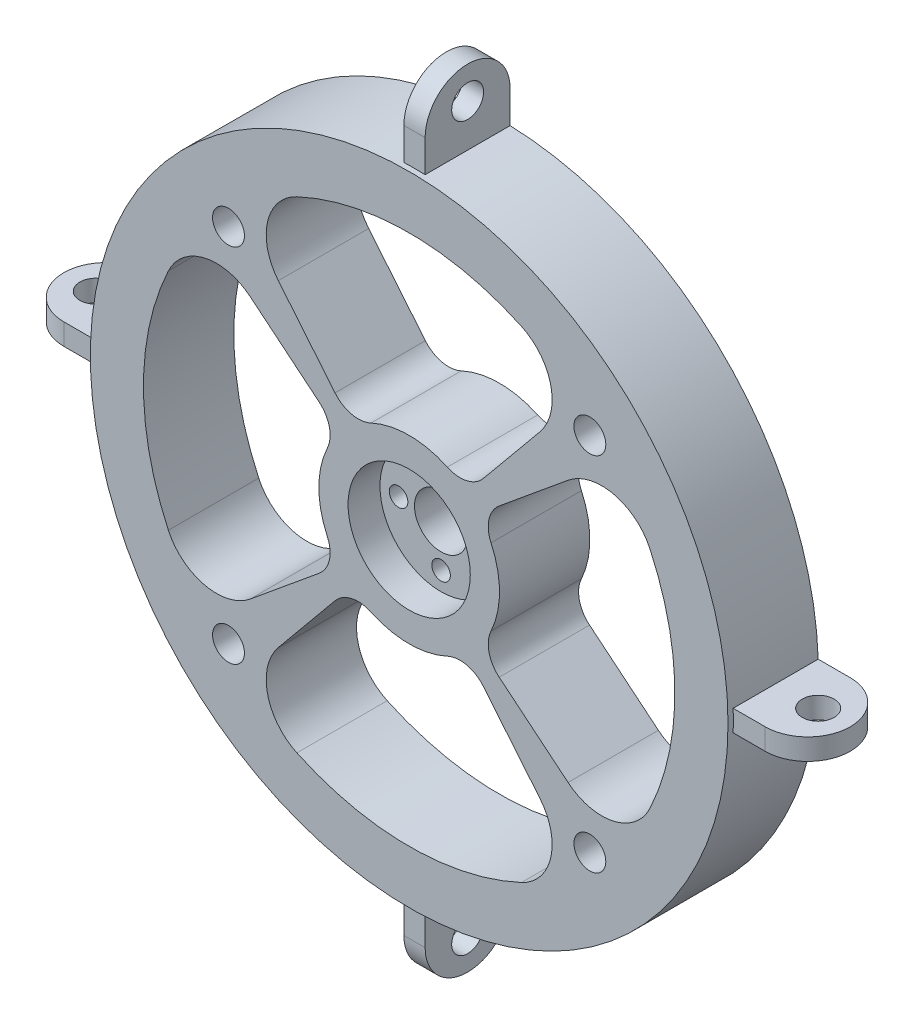
from build123d import *

# Parameters (mm, degrees)
SKETCH_1_R               = 60
EXTRUDE_1_DEPTH          = 17
SKETCH_2_R               = 3
CUT_EXTRUDE_1_DEPTH      = 87.539008545
EXTRUDE_2_DEPTH          = 2
SKETCH_4_R               = 3
CUT_EXTRUDE_7_DEPTH      = 99.025506885
CUT_EXTRUDE_3_REACH      = 98.773
SKETCH_5_R               = 5
SKETCH_6_R               = 11.5
CUT_EXTRUDE_4_DEPTH      = 6
CUT_EXTRUDE_5_REACH      = 97.901
SKETCH_7_R               = 1.75
CUT_EXTRUDE_6_REACH      = 98.773
PATTERN_CIRCULAR_3_COUNT = 4
PATTERN_CIRCULAR_4_COUNT = 4


with BuildPart() as part:
    # 草图1 → 凸台-拉伸1 (new body)
    with BuildSketch(Plane.XY):
        Circle(SKETCH_1_R)
    extrude(amount=EXTRUDE_1_DEPTH)

    # 草图2 → 切除-拉伸1 (cut, through all)
    with BuildSketch(Plane.XY.offset(17)):
        with Locations((-34, 34)):
            Circle(SKETCH_2_R)
        with Locations((34, 34)):
            Circle(SKETCH_2_R)
        with Locations((34, -34)):
            Circle(SKETCH_2_R)
        with Locations((-34, -34)):
            Circle(SKETCH_2_R)
    extrude(amount=-CUT_EXTRUDE_1_DEPTH, mode=Mode.SUBTRACT)

    # 草图3 → 凸台-拉伸2 (add, symmetric)
    with BuildSketch(Plane(origin=(0, 0, 0), x_dir=(0, 0, -1), z_dir=(1, 0, 0))):
        with BuildLine():
            Line((0, 58), (-16, 58))
            Line((-16, 58), (-16, 66))
            ThreePointArc((-16, 66), (-8, 74), (0, 66))
            Line((0, 66), (0, 58))
        make_face()
    extrude_2 = extrude(amount=EXTRUDE_2_DEPTH, both=True)

    # 草图4 → 切除-拉伸7 (cut, through all)
    with BuildSketch(Plane(origin=(2, 0, 0), x_dir=(0, 0, -1), z_dir=(1, 0, 0))):
        with Locations((-8, 67.966657402)):
            Circle(SKETCH_4_R)
    cut_extrude_7 = extrude(amount=-CUT_EXTRUDE_7_DEPTH, mode=Mode.SUBTRACT)

    # 草图5 → 切除-拉伸3 (cut, up to next)
    with BuildSketch(Plane(origin=(0, 0, 0), x_dir=(-1, 0, 0), z_dir=(0, 0, -1)), mode=Mode.PRIVATE) as cut_extrude_3_sk1:
        Circle(SKETCH_5_R)
    cut_extrude_3_tool1 = extrude(cut_extrude_3_sk1.sketch, amount=-CUT_EXTRUDE_3_REACH, mode=Mode.PRIVATE) & part.part
    add(cut_extrude_3_tool1.solids().sort_by_distance((0, 0, 0))[0], mode=Mode.SUBTRACT)

    # 草图6 → 切除-拉伸4 (cut)
    with BuildSketch(Plane.XY.offset(17)):
        Circle(SKETCH_6_R)
    extrude(amount=-CUT_EXTRUDE_4_DEPTH, mode=Mode.SUBTRACT)

    # 草图7 → 切除-拉伸5 (cut, up to next)
    with BuildSketch(Plane.XY.offset(11), mode=Mode.PRIVATE) as cut_extrude_5_sk1:
        with Locations((-8, 0)):
            Circle(SKETCH_7_R)
    cut_extrude_5_tool1 = extrude(cut_extrude_5_sk1.sketch, amount=-CUT_EXTRUDE_5_REACH, mode=Mode.PRIVATE) & part.part
    # 草图7 → 切除-拉伸5 (cut, up to next)
    with BuildSketch(Plane.XY.offset(11), mode=Mode.PRIVATE) as cut_extrude_5_sk2:
        with Locations((0, 8)):
            Circle(SKETCH_7_R)
    cut_extrude_5_tool2 = extrude(cut_extrude_5_sk2.sketch, amount=-CUT_EXTRUDE_5_REACH, mode=Mode.PRIVATE) & part.part
    # 草图7 → 切除-拉伸5 (cut, up to next)
    with BuildSketch(Plane.XY.offset(11), mode=Mode.PRIVATE) as cut_extrude_5_sk3:
        with Locations((8, 0)):
            Circle(SKETCH_7_R)
    cut_extrude_5_tool3 = extrude(cut_extrude_5_sk3.sketch, amount=-CUT_EXTRUDE_5_REACH, mode=Mode.PRIVATE) & part.part
    # 草图7 → 切除-拉伸5 (cut, up to next)
    with BuildSketch(Plane.XY.offset(11), mode=Mode.PRIVATE) as cut_extrude_5_sk4:
        with Locations((0, -8)):
            Circle(SKETCH_7_R)
    cut_extrude_5_tool4 = extrude(cut_extrude_5_sk4.sketch, amount=-CUT_EXTRUDE_5_REACH, mode=Mode.PRIVATE) & part.part
    add(cut_extrude_5_tool1.solids().sort_by_distance((-8, 0, 11))[0], mode=Mode.SUBTRACT)
    add(cut_extrude_5_tool2.solids().sort_by_distance((0, 8, 11))[0], mode=Mode.SUBTRACT)
    add(cut_extrude_5_tool3.solids().sort_by_distance((8, 0, 11))[0], mode=Mode.SUBTRACT)
    add(cut_extrude_5_tool4.solids().sort_by_distance((0, -8, 11))[0], mode=Mode.SUBTRACT)

    # 草图8 → 切除-拉伸6 (cut, up to next)
    with BuildSketch(Plane.XY.offset(17), mode=Mode.PRIVATE) as cut_extrude_6_sk1:
        with BuildLine():
            Line((-16.940249698, 13.95330093), (-29.89455829, 24.62347223))
            ThreePointArc((-29.89455829, 24.62347223), (-38.461199832, 26.657720383), (-45.315389352, 21.130913087))
            ThreePointArc((-45.315389352, 21.130913087), (-50, 0), (-45.315389352, -21.130913087))
            ThreePointArc((-45.315389352, -21.130913087), (-38.461199832, -26.657720383), (-29.89455829, -24.62347223))
            Line((-29.89455829, -24.62347223), (-16.940249698, -13.95330093))
            ThreePointArc((-16.940249698, -13.95330093), (-15.016282222, -10.831050665), (-15.40723238, -7.18451045))
            ThreePointArc((-15.40723238, -7.18451045), (-17, 0), (-15.40723238, 7.18451045))
            ThreePointArc((-15.40723238, 7.18451045), (-15.016282222, 10.831050665), (-16.940249698, 13.95330093))
        make_face()
    cut_extrude_6_tool1 = extrude(cut_extrude_6_sk1.sketch, amount=-CUT_EXTRUDE_6_REACH, mode=Mode.PRIVATE) & part.part
    cut_extrude_6 = cut_extrude_6_tool1.solids().sort_by_distance((-33.317048, 0, 17))[0]
    add(cut_extrude_6, mode=Mode.SUBTRACT)

    # 阵列(圆周)3: 切除-拉伸6 ×4 about axis
    pattern_circular_3_axis = Axis((0, 0, 17), (0, 0, 1))
    for i in range(1, PATTERN_CIRCULAR_3_COUNT):
        add(cut_extrude_6.rotate(pattern_circular_3_axis, i * 360 / PATTERN_CIRCULAR_3_COUNT), mode=Mode.SUBTRACT)

    # 阵列(圆周)4: 凸台-拉伸2, 切除-拉伸7 ×4 about axis
    pattern_circular_4_axis = Axis((0, 0, 17), (0, 0, 1))
    add([extrude_2.rotate(pattern_circular_4_axis, i * 360 / PATTERN_CIRCULAR_4_COUNT) for i in range(1, PATTERN_CIRCULAR_4_COUNT)])
    add([cut_extrude_7.rotate(pattern_circular_4_axis, i * 360 / PATTERN_CIRCULAR_4_COUNT) for i in range(1, PATTERN_CIRCULAR_4_COUNT)], mode=Mode.SUBTRACT)


solid = part.part
